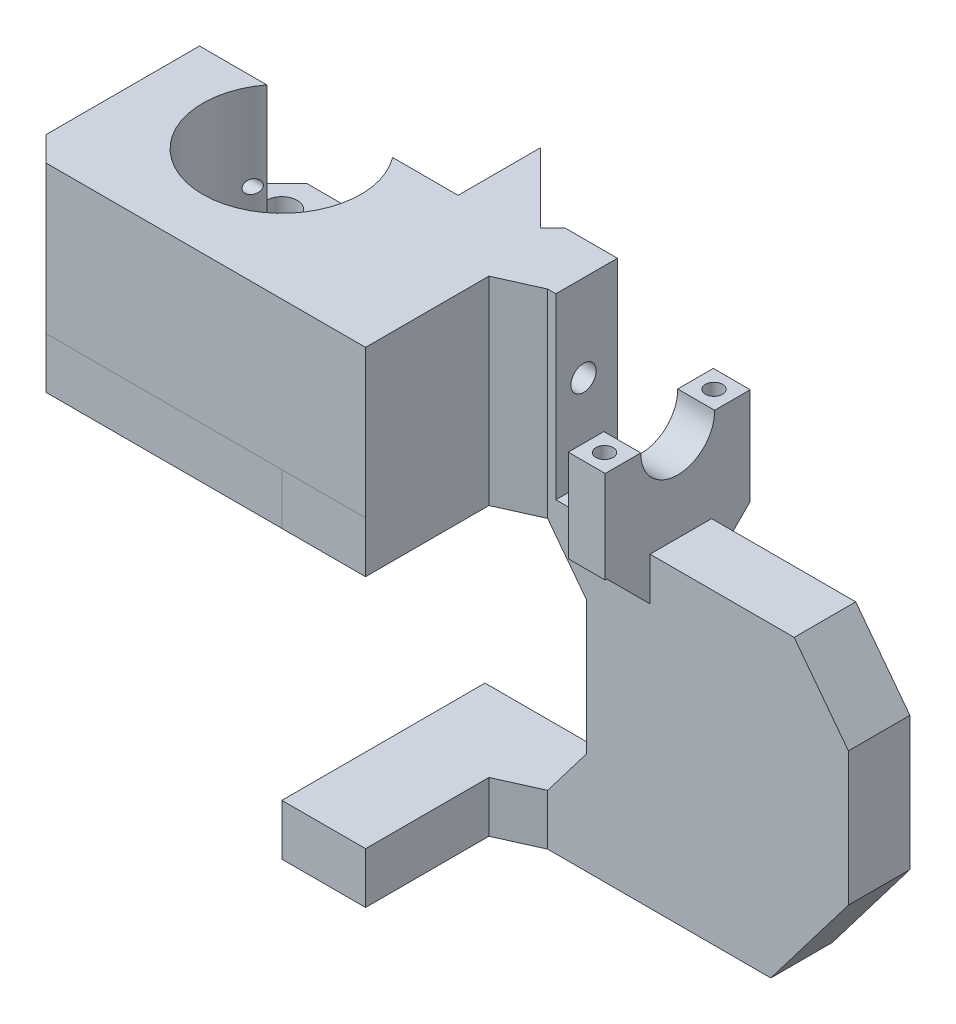
from build123d import *
from build123d.topology import SkipClean

# Parameters (mm, degrees)
SKICA1_R                  = 5.15
P_IDAT_VYSUNUT_M1_DEPTH   = 7
P_IDAT_VYSUNUT_M6_DEPTH   = 1
SKICA10_W                 = 20.181315219
SKICA10_H                 = 8.27896674
P_IDAT_VYSUNUT_M7_DEPTH   = 23
ODEBRAT_START             = -54.815867
ODEBRAT_VYSUNUT_M3_DEPTH  = 54.815867
SKICA12_R                 = 12.841751151
SKICA12_R_2               = 1.6
P_IDAT_VYSUNUT_M8_DEPTH   = 8.27896674
SKICA13_R                 = 2.5
ODEBRAT_VYSUNUT_M4_DEPTH  = 5
P_IDAT_VYSUNUT_M9_DEPTH   = 22
SKICA15_R                 = 1.749999821
ODEBRAT_VYSUNUT_M5_DEPTH  = 22
SKICA18_W                 = 3
SKICA18_H                 = 6
ODEBRAT_VYSUNUT_M6_DEPTH  = 8
P_IDAT_VYSUNUT_M10_DEPTH  = 2
SKICA20_R                 = 1.1
ODEBRAT_VYSUNUT_M7_DEPTH  = 51
SKICA21_R                 = 2.05
ODEBRAT_VYSUNUT_M8_DEPTH  = 30
P_IDAT_START              = 2
SKICA22_R                 = 5.15
P_IDAT_VYSUNUT_M11_DEPTH  = 2
SKICA23_R                 = 5.15
P_IDAT_VYSUNUT_M12_DEPTH  = 2
ZKOSEN_1_SIZE             = 2
SKICA24_W                 = 46.644065318
SKICA24_H                 = 8.415614868
ODEBRAT_VYSUNUT_M9_DEPTH  = 10
P_IDAT_VYSUNUT_M13_DEPTH  = 24
SKICA26_W                 = 6
SKICA26_H                 = 23.568213348
P_IDAT_VYSUNUT_M14_DEPTH  = 15
SKICA27_R                 = 6
ODEBRAT_VYSUNUT_M10_DEPTH = 6
ZKOSEN_2_SIZE             = 7
SKICA28_R                 = 1.4
ODEBRAT_VYSUNUT_M11_DEPTH = 10
ODEBRAT_START_2           = -10
SKICA29_R                 = 2.05
ODEBRAT_VYSUNUT_M12_DEPTH = 10


# Some blends are built 0.0001 mm under size
with BuildPart() as part:
    # Skica1 → Přidat vysunutím1 (new body)
    with BuildSketch(Plane.XY):
        Polygon((15.483860416, -19.94140889), (15.483860416, 1.75859111), (9.181315219, 10.03755785), (-11, 10.03755785), (-11, 18.31652459), (2.878770021, 18.31652459), (45.432583607, 18.31652459), (58.037674001, 1.75859111), (58.037674001, -19.94140889), (45.432583607, -36.49934237), (2.878770021, -36.49934237), (-11, -36.49934237), (-11, -28.22037563), (9.181315219, -28.22037563), align=None)
        with Locations((45.216218307, -9.09140889)):
            Circle(SKICA1_R, mode=Mode.SUBTRACT)
        with Locations((24.263711451, -9.09140889)):
            Circle(SKICA1_R, mode=Mode.SUBTRACT)
    extrude(amount=P_IDAT_VYSUNUT_M1_DEPTH)

    # Skica9 → Přidat vysunutím6 (add)
    with BuildSketch(Plane.XY.offset(7)):
        Polygon((45.432583607, -36.49934237), (58.037674001, -19.94140889), (58.037674001, 1.75859111), (45.432583607, 18.31652459), (-11, 18.31652459), (-11, 10.03755785), (9.181315219, 10.03755785), (15.483860416, 1.75859111), (15.483860416, -19.94140889), (9.181315219, -28.22037563), (-11, -28.22037563), (-11, -36.49934237), align=None)
    extrude(amount=P_IDAT_VYSUNUT_M6_DEPTH)

    # Skica10 → Přidat vysunutím7 (add)
    with BuildSketch(Plane.XY.offset(8)):
        with Locations((-0.90934239, -32.359859)):
            Rectangle(SKICA10_W, SKICA10_H)
        with Locations((-0.90934239, 14.17704122)):
            Rectangle(SKICA10_W, SKICA10_H)
    extrude(amount=P_IDAT_VYSUNUT_M7_DEPTH)

    # Skica11 → Odebrat vysunutím3 (cut)
    with BuildSketch(Plane.XZ.offset(36.49934237).offset(ODEBRAT_START)):
        Polygon((9.181315219, 8), (2.591972534, 10.953667824), (2.591972534, 31), (9.181315219, 31), align=None)
    extrude(amount=ODEBRAT_VYSUNUT_M3_DEPTH, mode=Mode.SUBTRACT)

    # Skica12 → Přidat vysunutím8 (add)
    with BuildSketch(Plane.XZ.offset(-10.03755785)):
        Polygon((0, 0), (-11.283883078, -11.283883078), (-49.3, -11.283883078), (-53.3, -7.283883078), (-53.3, 27.016116922), (-49.3, 31.016116922), (-11, 31), (-11, 0), align=None)
        with Locations(Location((-32.15, 9.866116922, 0), (0, 0, 270))):
            Circle(SKICA12_R, mode=Mode.SUBTRACT)
        with Locations(Location((-47.65, 25.366116922, 0), (0, 0, 270))):
            Circle(SKICA12_R_2, mode=Mode.SUBTRACT)
        with Locations(Location((-16.65, 25.366116922, 0), (0, 0, 270))):
            Circle(SKICA12_R_2, mode=Mode.SUBTRACT)
        with Locations(Location((-16.65, -5.633883078, 0), (0, 0, 270))):
            Circle(SKICA12_R_2, mode=Mode.SUBTRACT)
        with Locations(Location((-47.65, -5.633883078, 0), (0, 0, 270))):
            Circle(SKICA12_R_2, mode=Mode.SUBTRACT)
    extrude(amount=-P_IDAT_VYSUNUT_M8_DEPTH)

    # Skica13 → Odebrat vysunutím4 (cut)
    with BuildSketch(Plane(origin=(0, 18.31652459, 0), x_dir=(1, 0, 0), z_dir=(0, 1, 0))):
        with Locations(Location((-47.65, 5.633883078, 0), (0, 0, 270))):
            Circle(SKICA13_R)
    extrude(amount=-ODEBRAT_VYSUNUT_M4_DEPTH, mode=Mode.SUBTRACT)

    # Skica14 → Přidat vysunutím9 (add)
    with BuildSketch(Plane(origin=(0, 18.31652459, 0), x_dir=(1, 0, 0), z_dir=(0, 1, 0))):
        with BuildLine():
            Line((-42.368341227, -2.088194628), (-53.3, -2.088194628))
            Line((-53.3, -2.088194628), (-53.3, -27.016116922))
            Line((-53.3, -27.016116922), (-49.3, -31.016116922))
            Line((-49.3, -31.016116922), (2.591972534, -31))
            Line((2.591972534, -31), (2.591972534, -10.953667824))
            Line((2.591972534, -10.953667824), (2.591972534, -2.591972534))
            Line((2.591972534, -2.591972534), (-11.283883078, 11.283883078))
            Line((-11.283883078, 11.283883078), (-11.283883078, -2.088194628))
            Line((-11.283883078, -2.088194628), (-21.931658773, -2.088194628))
            ThreePointArc((-21.931658773, -2.088194628), (-32.15, -22.707868073), (-42.368341227, -2.088194628))
        make_face()
    extrude(amount=P_IDAT_VYSUNUT_M9_DEPTH)

    # Skica15 → Odebrat vysunutím5 (cut)
    with BuildSketch(Plane(origin=(0, 0, 2.088194628), x_dir=(-1, 0, 0), z_dir=(0, 0, -1))):
        with Locations((49.150002214, 36.816524362)):
            Circle(SKICA15_R)
        with Locations((49.150002214, 21.816524232)):
            Circle(SKICA15_R)
    extrude(amount=-ODEBRAT_VYSUNUT_M5_DEPTH, mode=Mode.SUBTRACT)

    # Skica18 → Odebrat vysunutím6 (cut)
    with BuildSketch(Plane.ZY.offset(53.3)):
        with Locations((14.552155775, 36.816524362)):
            Rectangle(SKICA18_W, SKICA18_H)
        with Locations((14.552155775, 21.816524232)):
            Rectangle(SKICA18_W, SKICA18_H)
    extrude(amount=-ODEBRAT_VYSUNUT_M6_DEPTH, mode=Mode.SUBTRACT)

    # Skica19 → Přidat vysunutím10 (add)
    with BuildSketch(Plane(origin=(0, 40.31652459, 0), x_dir=(1, 0, 0), z_dir=(0, 1, 0))):
        with BuildLine():
            Line((-42.368341227, -2.088194628), (-53.3, -2.088194628))
            Line((-53.3, -2.088194628), (-53.3, -27.016116922))
            Line((-53.3, -27.016116922), (-49.3, -31.016116922))
            Line((-49.3, -31.016116922), (2.591972534, -31))
            Line((2.591972534, -31), (2.591972534, -2.591972534))
            Line((2.591972534, -2.591972534), (-11.283883078, 11.283883078))
            Line((-11.283883078, 11.283883078), (-11.283883078, -2.088194628))
            Line((-11.283883078, -2.088194628), (-21.931658773, -2.088194628))
            ThreePointArc((-21.931658773, -2.088194628), (-32.15, -22.707868073), (-42.368341227, -2.088194628))
        make_face()
    extrude(amount=P_IDAT_VYSUNUT_M10_DEPTH)

    # Skica20 → Odebrat vysunutím7 (cut, symmetric)
    with BuildSketch(Plane.ZY.offset(33.3)):
        with Locations((3.507048003, 28.229718278)):
            Circle(SKICA20_R)
    extrude(amount=ODEBRAT_VYSUNUT_M7_DEPTH, both=True, mode=Mode.SUBTRACT)

    # Skica21 → Odebrat vysunutím8 (cut)
    with BuildSketch(Plane(origin=(2.591972534, 0, 0), x_dir=(0, 0, -1), z_dir=(1, 0, 0))):
        with Locations(Location((-3.507048003, 28.229718278, 0), (0, 0, 313.798445967))):
            Circle(SKICA21_R)
    extrude(amount=-ODEBRAT_VYSUNUT_M8_DEPTH, mode=Mode.SUBTRACT)

    # Skica22 → Přidat vysunutím11 (add)
    with BuildSketch(Plane(origin=(0, 0, 0), x_dir=(-1, 0, 0), z_dir=(0, 0, -1)).offset(P_IDAT_START)):
        Polygon((-9.181315219, 10.03755785), (0, 10.03755785), (0, 18.31652459), (-45.432583607, 18.31652459), (-58.037674001, 1.75859111), (-58.037674001, -19.94140889), (-45.432583607, -36.49934237), (11, -36.49934237), (11, -28.22037563), (-9.181315219, -28.22037563), (-15.483860416, -19.94140889), (-15.483860416, 1.75859111), align=None)
        with Locations((-45.216218307, -9.09140889)):
            Circle(SKICA22_R, mode=Mode.SUBTRACT)
        with Locations((-24.263711451, -9.09140889)):
            Circle(SKICA22_R, mode=Mode.SUBTRACT)
    extrude(amount=-P_IDAT_VYSUNUT_M11_DEPTH)

    # Skica23 → Přidat vysunutím12 (add)
    with BuildSketch(Plane(origin=(0, 0, 7), x_dir=(-1, 0, 0), z_dir=(0, 0, -1)).offset(P_IDAT_START)):
        with Locations((-45.216218307, -9.09140889)):
            Circle(SKICA23_R)
        with Locations((-24.263711451, -9.09140889)):
            Circle(SKICA23_R)
    extrude(amount=-P_IDAT_VYSUNUT_M12_DEPTH)

    # Zkosení1
    zkosen_1_edges = [part.edges().sort_by_distance(p)[0] for p in [
        (0, 14.17704122, -2),
    ]]
    chamfer(zkosen_1_edges, length=ZKOSEN_1_SIZE - 0.0001)  # a hair under: the kernel refuses the full size

    # Skica24 → Odebrat vysunutím9 (cut)
    with BuildSketch(Plane(origin=(0, 0, -2), x_dir=(-1, 0, 0), z_dir=(0, 0, -1))):
        with Locations((-33.832316059, 17.537237537)):
            Rectangle(SKICA24_W, SKICA24_H)
    extrude(amount=-ODEBRAT_VYSUNUT_M9_DEPTH, mode=Mode.SUBTRACT)

    # Skica25 → Přidat vysunutím13 (add)
    with SkipClean():  # the faces are left unmerged after this step: merging them gives an invalid solid
        with BuildSketch(Plane(origin=(0, 18.31652459, 0), x_dir=(1, 0, 0), z_dir=(0, 1, 0))):
            Polygon((9.181315219, -8), (10.5102834, -8), (10.5102834, 2), (2, 2), (0, 0), (2.591972534, -2.591972534), (2.591972534, -10.953667824), align=None)
        extrude(amount=P_IDAT_VYSUNUT_M13_DEPTH)

    # Skica26 → Přidat vysunutím14 (add)
    with SkipClean():  # the faces are left unmerged after this step: merging them gives an invalid solid
        with BuildSketch(Plane(origin=(0, 13.329430103, 0), x_dir=(1, 0, 0), z_dir=(0, 1, 0))):
            with Locations((22.815994553, -3.507048003)):
                Rectangle(SKICA26_W, SKICA26_H)
        extrude(amount=P_IDAT_VYSUNUT_M14_DEPTH)

    # Skica27 → Odebrat vysunutím10 (cut)
    with SkipClean():  # the faces are left unmerged after this step: merging them gives an invalid solid
        with BuildSketch(Plane(origin=(25.815994553, 0, 0), x_dir=(0, 0, -1), z_dir=(1, 0, 0))):
            with Locations((-3.507048003, 28.229718278)):
                Circle(SKICA27_R)
        extrude(amount=-ODEBRAT_VYSUNUT_M10_DEPTH, mode=Mode.SUBTRACT)

    # Zkosení2
    # the kernel refuses this chamfer: 7 mm, written as the material it adds along each edge
    with BuildSketch(Plane(origin=(25.815994553, 13.329430103, 8), x_dir=(0, -0.9996219169112968, -0.027495876610586365), z_dir=(-1, 0, 0))) as zkosen_2_piece_1:
        Polygon((ZKOSEN_2_SIZE * 0.999621916911, ZKOSEN_2_SIZE * 0.0274958766106), (-ZKOSEN_2_SIZE * 0.0274958766106, ZKOSEN_2_SIZE * 0.999621916911), (0, 0), align=None)
    extrude(amount=6)
    with BuildSketch(Plane(origin=(25.815994553, 13.329430103, -2), x_dir=(0, -0.9996219169112968, 0.027495876610586358), z_dir=(-1, 0, 0))) as zkosen_2_piece_2_section:
        Polygon((ZKOSEN_2_SIZE * 0.999621916911, -ZKOSEN_2_SIZE * 0.0274958766106), (-ZKOSEN_2_SIZE * 0.0274958766106, -ZKOSEN_2_SIZE * 0.999621916911), (0, 0), align=None)
    zkosen_2_piece_2 = extrude(amount=6, mode=Mode.PRIVATE)
    zkosen_2_piece_2 = split(zkosen_2_piece_2, bisect_by=Plane(origin=(22.815994553, 8.801515267, -8.277058671), z_dir=(0, 0, 1)), keep=Keep.TOP, mode=Mode.PRIVATE)
    add(zkosen_2_piece_2)

    # Skica28 → Odebrat vysunutím11 (cut)
    with SkipClean():  # the faces are left unmerged after this step: merging them gives an invalid solid
        with BuildSketch(Plane(origin=(0, 28.329430103, 0), x_dir=(1, 0, 0), z_dir=(0, 1, 0))):
            with Locations(Location((22.815994553, -12.398687042, 0), (0, 0, 270))):
                Circle(SKICA28_R)
            with Locations(Location((22.815994553, 5.384591037, 0), (0, 0, 270))):
                Circle(SKICA28_R)
        extrude(amount=-ODEBRAT_VYSUNUT_M11_DEPTH, mode=Mode.SUBTRACT)

    # Skica29 → Odebrat vysunutím12 (cut)
    with SkipClean():  # the faces are left unmerged after this step: merging them gives an invalid solid
        with BuildSketch(Plane.ZY.offset(-2.591972534).offset(ODEBRAT_START_2)):
            with Locations(Location((3.507048003, 28.229718278, 0), (0, 0, 226.201554033))):
                Circle(SKICA29_R)
        extrude(amount=ODEBRAT_VYSUNUT_M12_DEPTH, mode=Mode.SUBTRACT)


solid = part.part
